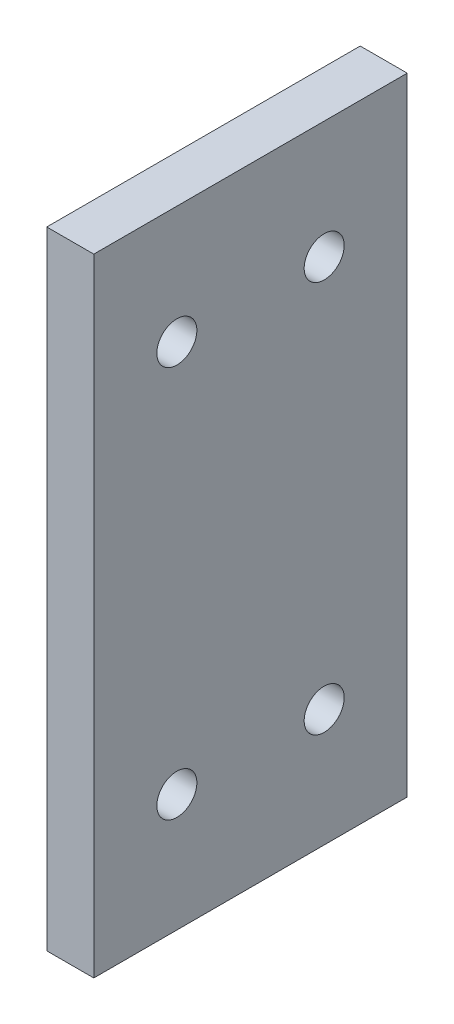
from build123d import *

# Parameters (mm, degrees)
SKETCH1_W           = 80
SKETCH1_H           = 40
BOSS_EXTRUDE2_DEPTH = 6
CUT_EXTRUDE3_REACH  = 47.122
SKETCH1_3_R         = 2.555


with BuildPart() as part:
    # Sketch1 → Boss-Extrude2 (new body)
    with BuildSketch(Plane.YZ):
        Rectangle(SKETCH1_W, SKETCH1_H)
    extrude(amount=BOSS_EXTRUDE2_DEPTH)

    # Sketch1<3> → Cut-Extrude3 (cut, up to next)
    with BuildSketch(Plane.YZ, mode=Mode.PRIVATE) as cut_extrude3_sk1:
        with Locations((-25, 9.4)):
            Circle(SKETCH1_3_R)
    cut_extrude3_tool1 = extrude(cut_extrude3_sk1.sketch, amount=CUT_EXTRUDE3_REACH, mode=Mode.PRIVATE) & part.part
    # Sketch1<3> → Cut-Extrude3 (cut, up to next)
    with BuildSketch(Plane.YZ, mode=Mode.PRIVATE) as cut_extrude3_sk2:
        with Locations((-25, -9.4)):
            Circle(SKETCH1_3_R)
    cut_extrude3_tool2 = extrude(cut_extrude3_sk2.sketch, amount=CUT_EXTRUDE3_REACH, mode=Mode.PRIVATE) & part.part
    # Sketch1<3> → Cut-Extrude3 (cut, up to next)
    with BuildSketch(Plane.YZ, mode=Mode.PRIVATE) as cut_extrude3_sk3:
        with Locations((25, -9.4)):
            Circle(SKETCH1_3_R)
    cut_extrude3_tool3 = extrude(cut_extrude3_sk3.sketch, amount=CUT_EXTRUDE3_REACH, mode=Mode.PRIVATE) & part.part
    # Sketch1<3> → Cut-Extrude3 (cut, up to next)
    with BuildSketch(Plane.YZ, mode=Mode.PRIVATE) as cut_extrude3_sk4:
        with Locations((25, 9.4)):
            Circle(SKETCH1_3_R)
    cut_extrude3_tool4 = extrude(cut_extrude3_sk4.sketch, amount=CUT_EXTRUDE3_REACH, mode=Mode.PRIVATE) & part.part
    add(cut_extrude3_tool1.solids().sort_by_distance((0, -25, 9.4))[0], mode=Mode.SUBTRACT)
    add(cut_extrude3_tool2.solids().sort_by_distance((0, -25, -9.4))[0], mode=Mode.SUBTRACT)
    add(cut_extrude3_tool3.solids().sort_by_distance((0, 25, -9.4))[0], mode=Mode.SUBTRACT)
    add(cut_extrude3_tool4.solids().sort_by_distance((0, 25, 9.4))[0], mode=Mode.SUBTRACT)


solid = part.part
